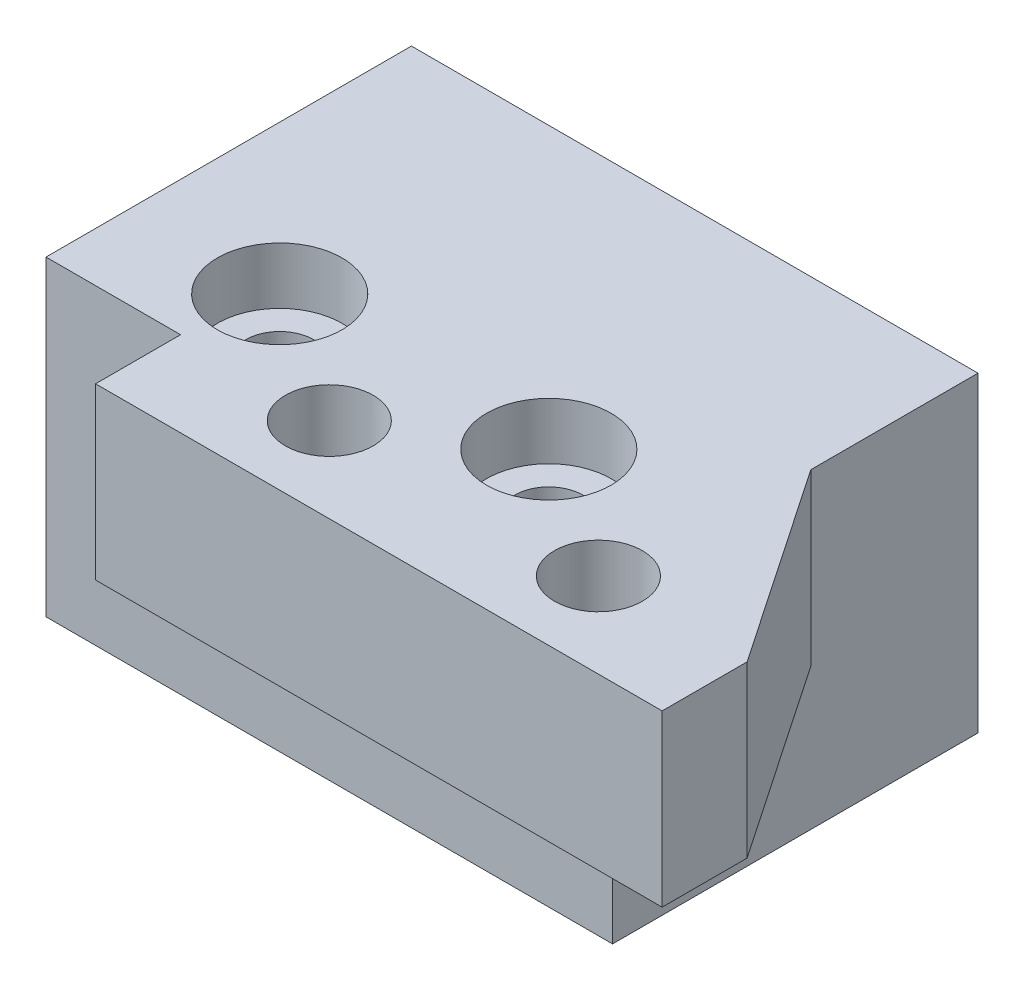
from build123d import *

# Parameters (mm, degrees)
SKETCH1_W                      = 20
SKETCH1_H                      = 12.9
SKETCH1_R                      = 1.175
BOSS_EXTRUDE1_DEPTH            = 11
SKETCH2_W                      = 20
SKETCH2_H                      = 6
BOSS_EXTRUDE2_DEPTH            = 3
CBORE_FOR_M2_SHCS1_D           = 2.4
CBORE_FOR_M2_SHCS1_CBORE_D     = 4.4
CBORE_FOR_M2_SHCS1_CBORE_DEPTH = 2
CHAMFER1_SIZE2                 = 4.75
CHAMFER1_SIZE                  = 7
SKETCH5_R                      = 1.55
CUT_EXTRUDE1_DEPTH             = 6


with BuildPart() as part:
    # Sketch1 → Boss-Extrude1 (new body)
    with BuildSketch(Plane(origin=(0, 0, 0), x_dir=(1, 0, 0), z_dir=(0, 1, 0))):
        with Locations((10, 6.45)):
            Rectangle(SKETCH1_W, SKETCH1_H)
        with Locations(Location((5.25, 3, 0), (0, 0, 270))):
            Circle(SKETCH1_R, mode=Mode.SUBTRACT)
        with Locations(Location((14.75, 3, 0), (0, 0, 270))):
            Circle(SKETCH1_R, mode=Mode.SUBTRACT)
    extrude(amount=BOSS_EXTRUDE1_DEPTH)

    # Sketch2 → Boss-Extrude2 (add)
    with BuildSketch(Plane.XY):
        with Locations((14.75, 8)):
            Rectangle(SKETCH2_W, SKETCH2_H)
    extrude(amount=BOSS_EXTRUDE2_DEPTH)

    # CBORE for M2 SHCS1 (through all)
    with Locations(Plane(origin=(0, 11, 0), x_dir=(1, 0, 0), z_dir=(0, 1, 0))):
        with Locations((5.25, 3), (14.75, 3)):
            CounterBoreHole(CBORE_FOR_M2_SHCS1_D / 2, CBORE_FOR_M2_SHCS1_CBORE_D / 2, CBORE_FOR_M2_SHCS1_CBORE_DEPTH)

    # Chamfer1
    chamfer1_edges = [part.edges().sort_by_distance(p)[0] for p in [
        (20, 8, 0),
    ]]
    chamfer1_side = [part.faces().sort_by_distance(p)[0] for p in [
        (20, 8, -0.095),
    ]]
    chamfer(chamfer1_edges, length=CHAMFER1_SIZE - 0.0001, length2=CHAMFER1_SIZE2 - 0.0001, reference=chamfer1_side[0])  # a hair under: the kernel refuses the full size

    # Sketch5 → Cut-Extrude1 (cut)
    with BuildSketch(Plane(origin=(0, 11, 0), x_dir=(1, 0, 0), z_dir=(0, 1, 0))):
        with Locations(Location((10, 0, 0), (0, 0, 270))):
            Circle(SKETCH5_R)
        with Locations(Location((19.5, 0, 0), (0, 0, 270))):
            Circle(SKETCH5_R)
    extrude(amount=-CUT_EXTRUDE1_DEPTH, mode=Mode.SUBTRACT)


solid = part.part
